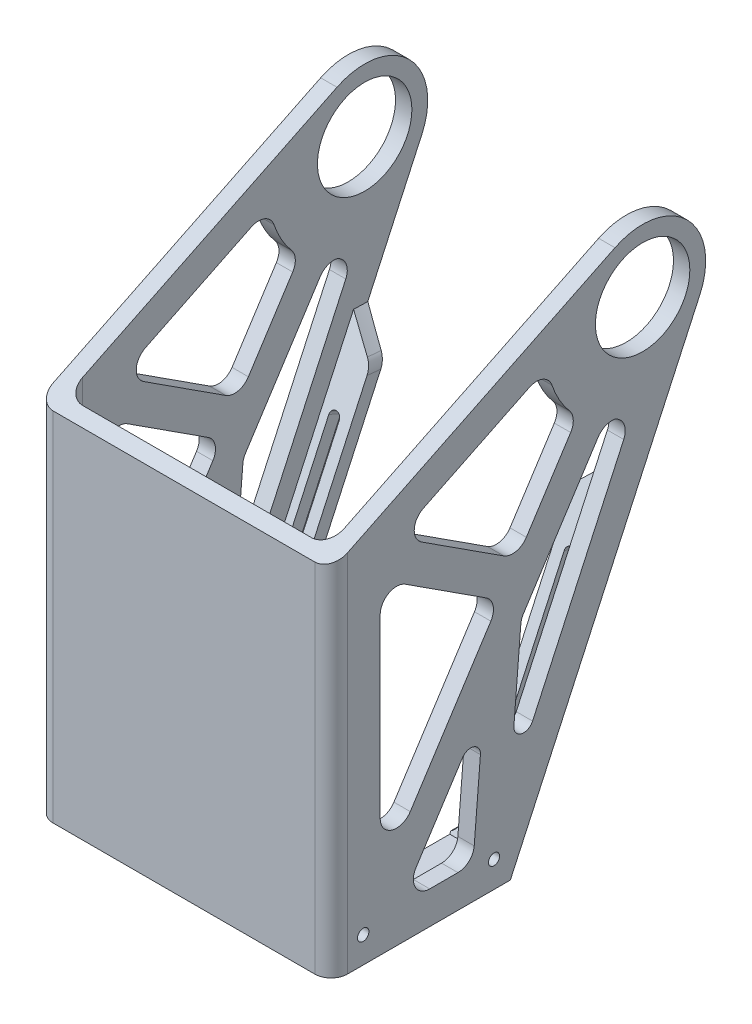
from build123d import *

# Parameters (mm, degrees)
SKETCH1_W            = 80
SKETCH1_H            = 104.14
BOSS_EXTRUDE1_DEPTH  = 4
BOSS_EXTRUDE2_DEPTH  = 50.8
SKETCH3_R            = 19.2875
SKETCH3_R_2          = 14.4375
BOSS_EXTRUDE3_DEPTH  = 5
BOSS_EXTRUDE4_DEPTH  = 80
SKETCH5_W            = 9
SKETCH5_H            = 138.232865643
SKETCH5_H_2          = 136.811211048
BOSS_EXTRUDE10_DEPTH = 4
CHAMFER2_SIZE        = 15
FILLET2_R            = 5
FILLET3_R            = 5
CUT_EXTRUDE1_REACH   = 205.652
SKETCH6_R            = 38.1
CHAMFER3_SIZE        = 15
FILLET4_R            = 5
SKETCH9_R            = 28.575
CUT_EXTRUDE6_DEPTH   = 6
SKETCH10_W           = 57.15
SKETCH10_H           = 24.031141128
CUT_EXTRUDE7_DEPTH   = 6
FILLET6_R            = 5
FILLET7_R            = 5
CUT_EXTRUDE8_DEPTH   = 6
FILLET8_START        = -5
FILLET8_DEPTH        = 5
FILLET9_R            = 3
FILLET9_OF_MIRROR3_R = 3
CUT_EXTRUDE9_DEPTH   = 10
SKETCH13_R           = 1.7
SKETCH13_R_2         = 1.75
CUT_EXTRUDE10_DEPTH  = 206.789362409


with BuildPart() as part:
    # Sketch1 → Boss-Extrude1 (new body)
    with BuildSketch(Plane.XY):
        Polygon((80, 104.14), (85, 104.14), (85, -5), (-5, -5), (-5, 104.14), (0, 104.14), (0, 0), (80, 0), align=None)
        with Locations((40, 52.07)):
            Rectangle(SKETCH1_W, SKETCH1_H)
    extrude(amount=BOSS_EXTRUDE1_DEPTH)

    # Sketch1<3> → Boss-Extrude2 (add)
    with BuildSketch(Plane.XY):
        Polygon((80, 104.14), (85, 104.14), (85, -5), (-5, -5), (-5, 104.14), (0, 104.14), (0, 0), (80, 0), align=None)
    extrude(amount=-BOSS_EXTRUDE2_DEPTH)

    # Sketch3 → Boss-Extrude3 (add)
    # profile 1 of 2: a face of its own
    with BuildSketch(Plane(origin=(85, 0, 0), x_dir=(0, 0, -1), z_dir=(1, 0, 0))):
        with Locations((91.25, 129.14)):
            Circle(SKETCH3_R)
        with Locations((91.25, 129.14)):
            Circle(SKETCH3_R_2, mode=Mode.SUBTRACT)
    # profile 2 of 2: a face of its own
    with BuildSketch(Plane(origin=(85, 0, 0), x_dir=(0, 0, -1), z_dir=(1, 0, 0))):
        with BuildLine():
            Line((82.794467828, 146.475271326), (-4, 104.14))
            Line((-4, 104.14), (50.8, 104.14))
            Line((50.8, 104.14), (50.8, -5))
            Line((50.8, -5), (108.773782558, 121.082413443))
            ThreePointArc((108.773782558, 121.082413443), (77.768249404, 115.346883705), (82.794467828, 146.475271326))
        make_face()
    boss_extrude3 = extrude(amount=-BOSS_EXTRUDE3_DEPTH)

    # Mirror1: Boss-Extrude3 across plane
    add(boss_extrude3.mirror(Plane.ZY.offset(-40)))

    # Sketch4 → Boss-Extrude4 (add)
    with BuildSketch(Plane.ZY.offset(-80)):
        Polygon((-50.8, -5), (-50.8, 0), (-53.09904318, 0), align=None)
        Polygon((0, 106.091058513), (0, 104.14), (4, 104.14), align=None)
    extrude(amount=BOSS_EXTRUDE4_DEPTH)

    # Sketch5 → Boss-Extrude10 (add)
    with BuildSketch(Plane(origin=(0, -20.154296917, -43.831923404), x_dir=(-1, 0, 0), z_dir=(0, -0.41776210274368286, -0.9085564514718811))):
        with Locations((-75.5, 86.335339197)):
            Rectangle(SKETCH5_W, SKETCH5_H)
        with Locations((-4.5, 87.046166494)):
            Rectangle(SKETCH5_W, SKETCH5_H_2)
    extrude(amount=-BOSS_EXTRUDE10_DEPTH)

    # Chamfer2
    # the kernel refuses this chamfer: 15 mm, written as the material it takes off along each edge
    with BuildSketch(Plane(origin=(9, 104.967138054, -143.821570106), x_dir=(-1, 0, 0), z_dir=(0, 0.41776210274368286, 0.9085564514718811))) as chamfer2_piece_1_section:
        Polygon((CHAMFER2_SIZE, 0), (0, CHAMFER2_SIZE), (0, 0), align=None)
    chamfer2_piece_1 = extrude(amount=81.150489639, mode=Mode.PRIVATE)
    chamfer2_piece_1 = split(chamfer2_piece_1, bisect_by=Plane(origin=(0, 104.967138054, -143.821570106), z_dir=(1, 0, 0)), keep=Keep.TOP, mode=Mode.PRIVATE)
    add(chamfer2_piece_1, mode=Mode.SUBTRACT)
    with BuildSketch(Plane(origin=(71, 104.967138054, -143.821570106), x_dir=(0, -0.908556451471881, 0.41776210274368286), z_dir=(0, 0.41776210274368286, 0.9085564514718811))) as chamfer2_piece_2_section:
        Polygon((CHAMFER2_SIZE, 0), (0, CHAMFER2_SIZE), (0, 0), align=None)
    chamfer2_piece_2 = extrude(amount=81.150489639, mode=Mode.PRIVATE)
    chamfer2_piece_2 = split(chamfer2_piece_2, bisect_by=Plane(origin=(80, 104.967138054, -143.821570106), z_dir=(-1, 0, 0)), keep=Keep.TOP, mode=Mode.PRIVATE)
    add(chamfer2_piece_2, mode=Mode.SUBTRACT)

    # Fillet2
    fillet2_edges = [part.edges().sort_by_distance(p)[0] for p in [
        (9, 108.289590877, -100.690238114),
        (71, 108.289590877, -100.690238114),
    ]]
    fillet(fillet2_edges, radius=FILLET2_R)

    # Fillet3
    fillet3_edges = [part.edges().sort_by_distance(p)[0] for p in [
        (71, 0, -50.897749032),
        (9, 0, -50.897749032),
    ]]
    fillet(fillet3_edges, radius=FILLET3_R)

    # Cut-Extrude1: up to this face of the body (flat: up to its plane)
    cut_extrude1_end = Plane(part.part.faces().sort_by_distance((80, 71.429769016, -42.89325433))[0])
    # Sketch6 → Cut-Extrude1 (cut, up to the picked face)
    with BuildSketch(Plane(origin=(0, 0, 0), x_dir=(0, 0, -1), z_dir=(1, 0, 0)), mode=Mode.PRIVATE) as cut_extrude1_sk1:
        with Locations((91.25, 129.14)):
            Circle(SKETCH6_R)
    cut_extrude1_tool1 = split(extrude(cut_extrude1_sk1.sketch, amount=CUT_EXTRUDE1_REACH, mode=Mode.PRIVATE), bisect_by=cut_extrude1_end, keep=Keep.BOTH, mode=Mode.PRIVATE)
    add(cut_extrude1_tool1.solids().sort_by(Axis((0, 129.14, -91.25), (1, 0, 0)))[0], mode=Mode.SUBTRACT)

    # Chamfer3
    # the kernel refuses this chamfer: 15 mm, written as the material it takes off along each edge
    with BuildSketch(Plane(origin=(71, 129.14, -91.25), x_dir=(0, -0.4425940330110398, -0.8967220985026645), z_dir=(0, 0.8967220985026645, -0.4425940330110398))) as chamfer3_piece_1_section:
        Polygon((38.1 + CHAMFER3_SIZE, 0), (38.1, -CHAMFER3_SIZE), (38.1, 0), align=None)
    chamfer3_piece_1 = revolve(axis=Axis((71, 129.14, -91.25), (-1, 0, 0)), revolution_arc=122.778328336, mode=Mode.PRIVATE)
    chamfer3_piece_1 = split(chamfer3_piece_1, bisect_by=Plane(origin=(80, 129.14, -91.25), z_dir=(-1, 0, 0)), keep=Keep.TOP, mode=Mode.PRIVATE)
    add(chamfer3_piece_1, mode=Mode.SUBTRACT)
    with BuildSketch(Plane(origin=(9, 129.14, -91.25), x_dir=(0, -0.4425940330110398, -0.8967220985026645), z_dir=(0, 0.8967220985026645, -0.4425940330110398))) as chamfer3_piece_2_section:
        Polygon((38.1 + CHAMFER3_SIZE, 0), (38.1, CHAMFER3_SIZE), (38.1, 0), align=None)
    chamfer3_piece_2 = revolve(axis=Axis((9, 129.14, -91.25), (-1, 0, 0)), revolution_arc=122.778328336, mode=Mode.PRIVATE)
    chamfer3_piece_2 = split(chamfer3_piece_2, bisect_by=Plane(origin=(0, 129.14, -91.25), z_dir=(1, 0, 0)), keep=Keep.TOP, mode=Mode.PRIVATE)
    add(chamfer3_piece_2, mode=Mode.SUBTRACT)

    # Fillet4
    fillet4_edges = [part.edges().sort_by_distance(p)[0] for p in [
        (71, 76.300518744, -85.996503963),
        (9, 76.300518744, -85.996503963),
    ]]
    fillet(fillet4_edges, radius=FILLET4_R)

    # Sketch9 → Cut-Extrude6 (cut)
    with BuildSketch(Plane.XZ.offset(5)):
        with Locations((40, -35.925)):
            Circle(SKETCH9_R)
    extrude(amount=-CUT_EXTRUDE6_DEPTH, mode=Mode.SUBTRACT)

    # Sketch10 → Cut-Extrude7 (cut)
    with BuildSketch(Plane.XZ.offset(5)):
        with Locations((40, -47.940570564)):
            Rectangle(SKETCH10_W, SKETCH10_H)
    extrude(amount=-CUT_EXTRUDE7_DEPTH, mode=Mode.SUBTRACT)

    # Fillet6
    fillet6_edges = [part.edges().sort_by_distance(p)[0] for p in [
        (80, 53.045529256, 0),
        (0, 53.045529256, 0),
    ]]
    fillet(fillet6_edges, radius=FILLET6_R)

    # Fillet7
    fillet7_edges = [part.edges().sort_by_distance(p)[0] for p in [
        (-5, 49.57, 4),
        (85, 49.57, 4),
    ]]
    fillet(fillet7_edges, radius=FILLET7_R)

    # Sketch11 → Cut-Extrude8 (cut)
    with BuildSketch(Plane.ZY.offset(5)):
        with BuildLine():
            ThreePointArc((-79.782568565, 102.190868798), (-83.853758277, 100.801805551), (-88.084504322, 100.024071484))
            Line((-88.084504322, 100.024071484), (-50.49441088, 18.272467678))
            Line((-50.49441088, 18.272467678), (-53.351511937, 53.187648584))
            Line((-53.351511937, 53.187648584), (-53.717955782, 57.665772695))
            Line((-53.717955782, 57.665772695), (-54.111950484, 62.480581838))
            Line((-54.111950484, 62.480581838), (-79.782568565, 102.190868798))
        make_face()
        Polygon((-39.408272291, 5.407785815), (-42.624386734, 44.71028696), (-16.953768653, 5), (-39.408272291, 5), align=None)
        Polygon((-11, 14.209979321), (-11, 94.376540909), (-47.549602253, 70.749139742), align=None)
        with BuildLine():
            ThreePointArc((-62.21392357, 125.310649948), (-65.248417903, 115.661298849), (-71.384526431, 107.619762638))
            Line((-71.384526431, 107.619762638), (-52.978496093, 79.147181876))
            Line((-52.978496093, 79.147181876), (-16.249254698, 102.890710327))
            Line((-16.249254698, 102.890710327), (-62.21392357, 125.310649948))
        make_face()
    cut_extrude8 = extrude(amount=-CUT_EXTRUDE8_DEPTH, mode=Mode.SUBTRACT)

    # Fillet8: read off the stored shape, not the designer's step
    # Fillet8 outline → Fillet8 (add)
    with BuildSketch(Plane.YZ.offset(FILLET8_START)):
        with BuildLine():
            ThreePointArc((61.228738224, -54.009512415), (62.430571825, -54.259027975), (63.535399329, -54.793834676))
            Line((63.535399329, -54.793834676), (62.480581838, -54.111950484))
            Line((62.480581838, -54.111950484), (61.228738224, -54.009512415))
        make_face()
        with BuildLine():
            Line((102.190868798, -79.782568565), (98.882629402, -77.643965282))
            ThreePointArc((98.882629402, -77.643965282), (100.773266088, -79.895371145), (101.071771481, -82.820132668))
            ThreePointArc((101.071771481, -82.820132668), (98.279527982, -85.583648622), (94.352418228, -85.476629174))
            Line((94.352418228, -85.476629174), (100.024071484, -88.084504322))
            ThreePointArc((100.024071484, -88.084504322), (100.801805551, -83.853758277), (102.190868798, -79.782568565))
        make_face()
        with BuildLine():
            ThreePointArc((5, -26.139775101), (7.609627079, -21.748178888), (12.71444692, -21.940754035))
            Line((12.71444692, -21.940754035), (5, -16.953768653))
            Line((5, -16.953768653), (5, -26.139775101))
        make_face()
        with BuildLine():
            ThreePointArc((9.592214185, -39.750683082), (6.323117552, -38.15563364), (5, -34.767339754))
            Line((5, -34.767339754), (5, -39.408272291))
            Line((5, -39.408272291), (5.407785815, -39.408272291))
            Line((5.407785815, -39.408272291), (9.592214185, -39.750683082))
        make_face()
        with BuildLine():
            Line((14.209979321, -11), (28.440091162, -20.199021067))
            ThreePointArc((28.440091162, -20.199021067), (26.358961718, -14.584921439), (31.154538082, -11))
            Line((31.154538082, -11), (14.209979321, -11))
        make_face()
        with BuildLine():
            ThreePointArc((73.463586662, -43.350581187), (70.314318041, -45.524694362), (66.550118675, -44.835155334))
            Line((66.550118675, -44.835155334), (70.749139742, -47.549602253))
            Line((70.749139742, -47.549602253), (73.463586662, -43.350581187))
        make_face()
        with BuildLine():
            Line((94.376540909, -11), (85.19053446, -11))
            ThreePointArc((85.19053446, -11), (89.582130673, -13.609627079), (89.389555527, -18.71444692))
            Line((89.389555527, -18.71444692), (94.376540909, -11))
        make_face()
        with BuildLine():
            Line((102.890710327, -16.249254698), (98.081396321, -23.688858944))
            ThreePointArc((98.081396321, -23.688858944), (102.580393028, -21.412312514), (106.774330888, -24.211333816))
            Line((106.774330888, -24.211333816), (102.890710327, -16.249254698))
        make_face()
        with BuildLine():
            ThreePointArc((83.346202943, -55.692943013), (81.172089767, -52.543674393), (81.861628795, -48.779475026))
            Line((81.861628795, -48.779475026), (79.147181876, -52.978496093))
            Line((79.147181876, -52.978496093), (83.346202943, -55.692943013))
        make_face()
        with BuildLine():
            Line((125.310649948, -62.21392357), (122.573977862, -56.603282846))
            ThreePointArc((122.573977862, -56.603282846), (122.696443672, -60.715942807), (119.692887641, -63.527992058))
            ThreePointArc((119.692887641, -63.527992058), (122.469332302, -62.732288859), (125.310649948, -62.21392357))
        make_face()
        with BuildLine():
            ThreePointArc((110.250764888, -68.867988179), (107.343495643, -70.036809652), (104.311523242, -69.245923148))
            Line((104.311523242, -69.245923148), (107.619762638, -71.384526431))
            ThreePointArc((107.619762638, -71.384526431), (108.896121725, -70.085334903), (110.250764888, -68.867988179))
        make_face()
    fillet8 = extrude(amount=FILLET8_DEPTH)

    # Fillet9
    fillet9_edges = [part.edges().sort_by_distance(p)[0] for p in [
        (-2.5, 44.71028696, -42.624386734),
        (-2.5, 18.272467678, -50.49441088),
    ]]
    fillet(fillet9_edges, radius=FILLET9_R)

    # Mirror3: Cut-Extrude8, Fillet8 across plane
    add(cut_extrude8.mirror(Plane.ZY.offset(-40)), mode=Mode.SUBTRACT)
    add(fillet8.mirror(Plane.ZY.offset(-40)))

    # Fillet9 of Mirror3
    fillet9_of_mirror3_edges = [part.edges().sort_by_distance(p)[0] for p in [
        (82.5, 44.71028696, -42.624386734),
        (82.5, 18.272467678, -50.49441088),
    ]]
    fillet(fillet9_of_mirror3_edges, radius=FILLET9_OF_MIRROR3_R)

    # Sketch12 → Cut-Extrude9 (cut)
    with BuildSketch(Plane(origin=(0, -20.154296917, -43.831923404), x_dir=(-1, 0, 0), z_dir=(0, -0.41776210274368286, -0.9085564514718811))):
        with BuildLine():
            Line((-5.6, 30.22073467), (-5.6, 90.22073467))
            ThreePointArc((-5.6, 90.22073467), (-4, 91.82073467), (-2.4, 90.22073467))
            Line((-2.4, 90.22073467), (-2.4, 30.22073467))
            ThreePointArc((-2.4, 30.22073467), (-4, 28.62073467), (-5.6, 30.22073467))
        make_face()
        with BuildLine():
            Line((-74.4, 30.22073467), (-74.4, 90.22073467))
            ThreePointArc((-74.4, 90.22073467), (-76, 91.82073467), (-77.6, 90.22073467))
            Line((-77.6, 90.22073467), (-77.6, 30.22073467))
            ThreePointArc((-77.6, 30.22073467), (-76, 28.62073467), (-74.4, 30.22073467))
        make_face()
    extrude(amount=-CUT_EXTRUDE9_DEPTH, mode=Mode.SUBTRACT)

    # Sketch13 → Cut-Extrude10 (cut, through all)
    with BuildSketch(Plane.ZY.offset(5)):
        with Locations((-45.8, 3)):
            Circle(SKETCH13_R)
        with Locations((-5.8, 3)):
            Circle(SKETCH13_R_2)
    extrude(amount=-CUT_EXTRUDE10_DEPTH, mode=Mode.SUBTRACT)


solid = part.part
